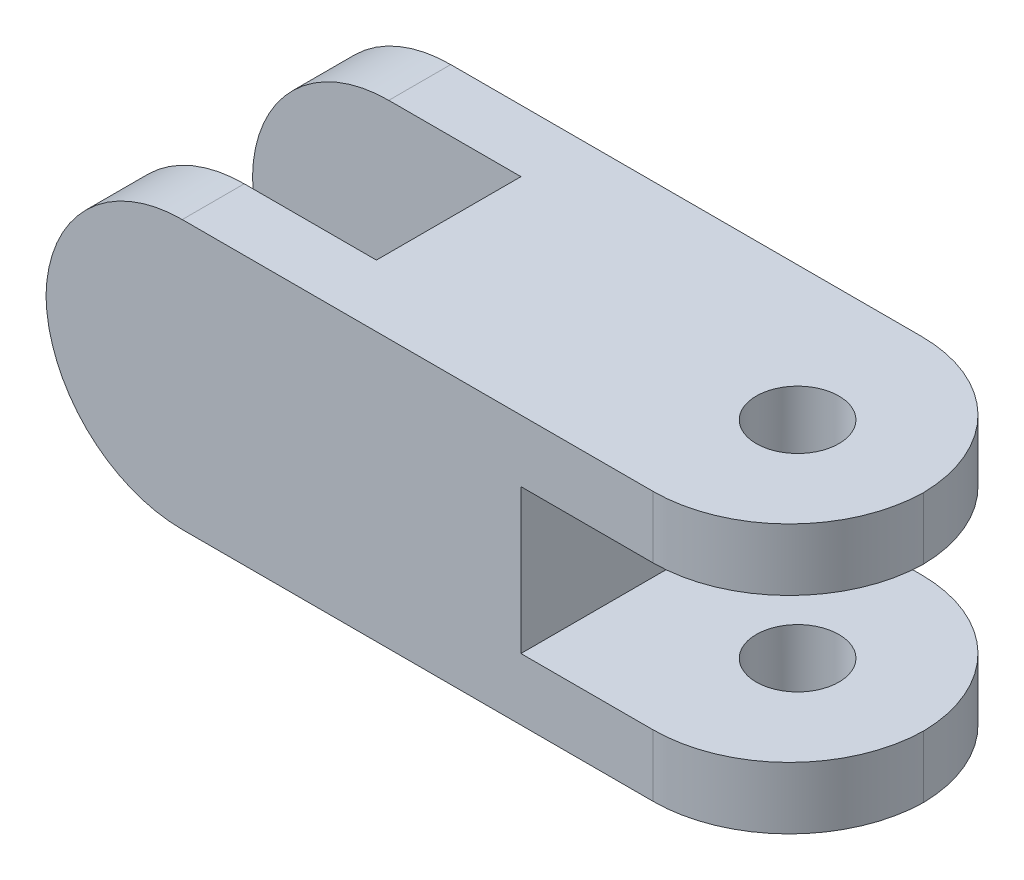
from build123d import *

# Parameters (mm, degrees)
ESBO_O1_W                  = 180
ESBO_O1_H                  = 65
RESSALTO_EXTRUS_O3_DEPTH   = 32.5
FILETE6_R                  = 33
CORTE_EXTRUS_O2_DEPTH      = 116.677353013
CORTE_EXTRUS_O2_DEPTH_BACK = 116.677353013
ESBO_O5_W                  = 65
ESBO_O5_H                  = 35
FILETE7_R                  = 33
CORTE_EXTRUS_O3_DEPTH      = 116.674405799
CORTE_EXTRUS_O3_DEPTH_BACK = 116.674405799
ESBO_O8_W                  = 65
ESBO_O8_H                  = 35
CORTE_EXTRUS_O4_DEPTH      = 116.674405799
CORTE_EXTRUS_O4_DEPTH_BACK = 116.674405799
ESBO_O11_R                 = 10


with BuildPart() as part:
    # Esboço1 → Ressalto-extrusão3 (new, symmetric)
    with BuildSketch(Plane(origin=(0, 0, 0), x_dir=(1, 0, 0), z_dir=(0, 1, 0))):
        Rectangle(ESBO_O1_W, ESBO_O1_H)
    extrude(amount=RESSALTO_EXTRUS_O3_DEPTH, both=True)

    # Filete6
    # the kernel refuses this fillet: 33 mm, written as the material it takes off along each edge
    with BuildSketch(Plane(origin=(90, 115, -32.5), x_dir=(-1, 0, 0), z_dir=(0, -1, 0))) as filete6_piece_1:
        with BuildLine():
            CenterArc((FILETE6_R, -FILETE6_R), FILETE6_R, 90, 90)
            Line((0, -FILETE6_R), (0, 0))
            Line((0, 0), (FILETE6_R, 0))
        make_face()
    extrude(amount=230, mode=Mode.SUBTRACT)
    with BuildSketch(Plane(origin=(90, 115, 32.5), x_dir=(-1, 0, 0), z_dir=(0, -1, 0))) as filete6_piece_2:
        with BuildLine():
            CenterArc((FILETE6_R, FILETE6_R), FILETE6_R, 180, 90)
            Line((0, FILETE6_R), (0, 0))
            Line((0, 0), (FILETE6_R, 0))
        make_face()
    extrude(amount=230, mode=Mode.SUBTRACT)

    # Esboço5 → Corte-extrusão2 (cut, two sides: drawn at the far end of the back side and taken through both)
    with BuildSketch(Plane.XY.offset(32.5).offset(-CORTE_EXTRUS_O2_DEPTH_BACK)):
        with Locations((57.496211904, 0)):
            Rectangle(ESBO_O5_W, ESBO_O5_H)
    extrude(amount=CORTE_EXTRUS_O2_DEPTH + CORTE_EXTRUS_O2_DEPTH_BACK, mode=Mode.SUBTRACT)

    # Filete7
    # the kernel refuses this fillet: 33 mm, written as the material it takes off along each edge
    with BuildSketch(Plane(origin=(-90, -32.5, 115), x_dir=(0, 1, 0), z_dir=(0, 0, -1))) as filete7_piece_1:
        with BuildLine():
            CenterArc((FILETE7_R, FILETE7_R), FILETE7_R, 180, 90)
            Line((0, FILETE7_R), (0, 0))
            Line((0, 0), (FILETE7_R, 0))
        make_face()
    extrude(amount=230, mode=Mode.SUBTRACT)
    with BuildSketch(Plane(origin=(-90, 32.5, 115), x_dir=(0, -1, 0), z_dir=(0, 0, -1))) as filete7_piece_2:
        with BuildLine():
            CenterArc((FILETE7_R, -FILETE7_R), FILETE7_R, 90, 90)
            Line((0, -FILETE7_R), (0, 0))
            Line((0, 0), (FILETE7_R, 0))
        make_face()
    extrude(amount=230, mode=Mode.SUBTRACT)

    # Esboço8 → Corte-extrusão3 (cut, two sides: drawn at the far end of the back side and taken through both)
    with BuildSketch(Plane(origin=(0, 32.5, 0), x_dir=(1, 0, 0), z_dir=(0, 1, 0)).offset(-CORTE_EXTRUS_O3_DEPTH_BACK)):
        with Locations((-57.496211904, 0)):
            Rectangle(ESBO_O8_W, ESBO_O8_H)
    extrude(amount=CORTE_EXTRUS_O3_DEPTH + CORTE_EXTRUS_O3_DEPTH_BACK, mode=Mode.SUBTRACT)

    # Esboço11 → Corte-extrusão4 (cut, two sides: drawn at the far end of the back side and taken through both)
    with BuildSketch(Plane(origin=(0, 32.5, 0), x_dir=(1, 0, 0), z_dir=(0, 1, 0)).offset(-CORTE_EXTRUS_O4_DEPTH_BACK)):
        with Locations(Location((59.485722432, 0, 0), (0, 0, 270))):
            Circle(ESBO_O11_R)
    extrude(amount=CORTE_EXTRUS_O4_DEPTH + CORTE_EXTRUS_O4_DEPTH_BACK, mode=Mode.SUBTRACT)


solid = part.part
